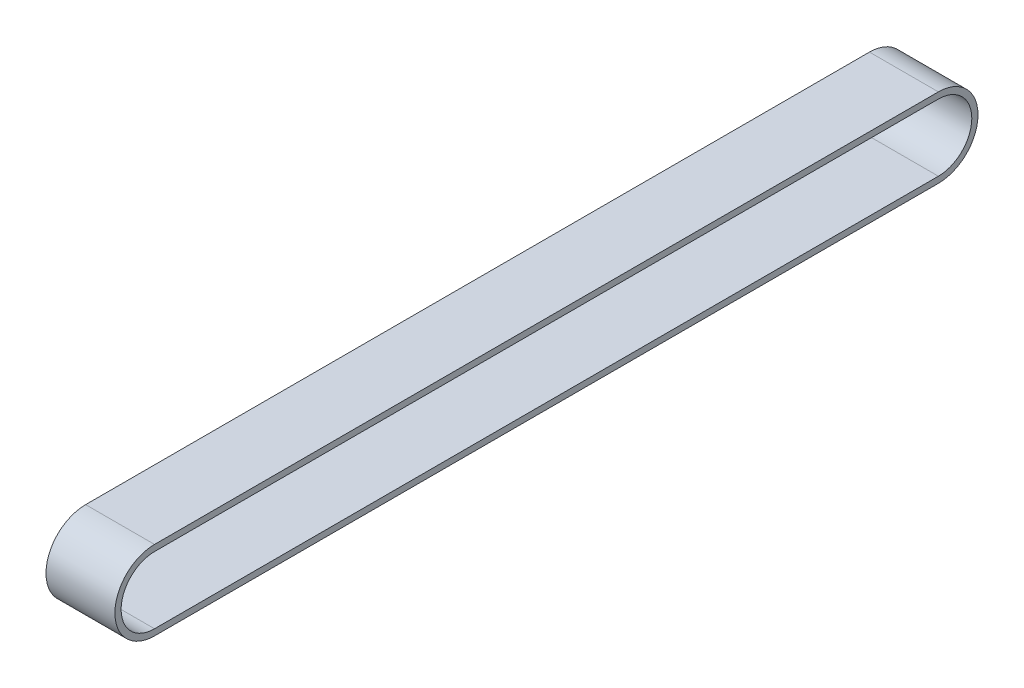
from build123d import *

# Parameters (mm, degrees)
BOSS_EXTRUDE1_DEPTH = 12.7


with BuildPart() as part:
    # Sketch1 → Boss-Extrude1 (new, symmetric)
    with BuildSketch(Plane(origin=(0, 0, 0), x_dir=(0, 0, -1), z_dir=(1, 0, 0))):
        with BuildLine():
            Line((-144.4625, 14.605), (144.4625, 14.605))
            ThreePointArc((144.4625, 14.605), (159.0675, 0), (144.4625, -14.605))
            Line((144.4625, -14.605), (-144.4625, -14.605))
            ThreePointArc((-144.4625, -14.605), (-159.0675, 0), (-144.4625, 14.605))
        make_face()
        with BuildLine():
            Line((-144.4625, 12.319), (144.4625, 12.319))
            ThreePointArc((144.4625, 12.319), (156.7815, 0), (144.4625, -12.319))
            Line((144.4625, -12.319), (-144.4625, -12.319))
            ThreePointArc((-144.4625, -12.319), (-156.7815, 0), (-144.4625, 12.319))
        make_face(mode=Mode.SUBTRACT)
    extrude(amount=BOSS_EXTRUDE1_DEPTH, both=True)


solid = part.part
